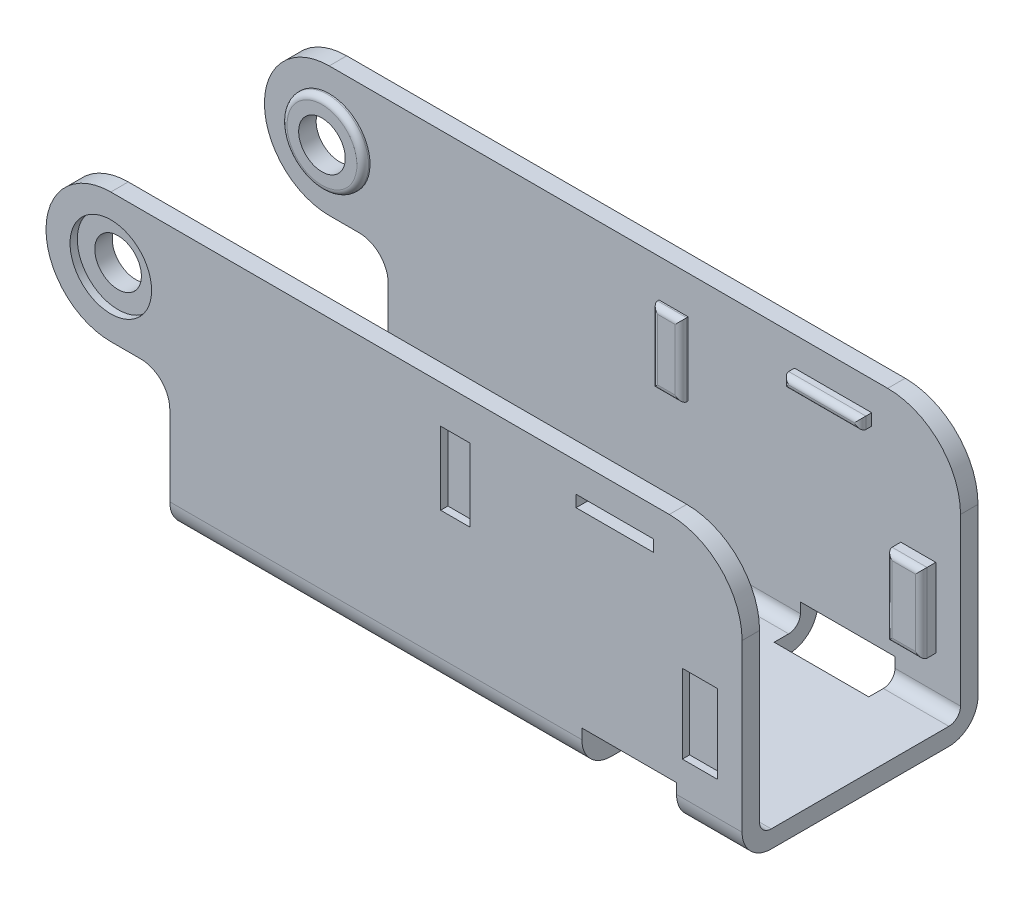
from build123d import *

# Parameters (mm, degrees)
BOSS_EXTRUDE1_DEPTH       = 10.287
SKETCH2_R                 = 3.556
CUT_EXTRUDE1_DEPTH        = 0.635
SKETCH3_W                 = 3.048
SKETCH3_H                 = 6.858
CUT_EXTRUDE2_DEPTH        = 0.635
SKETCH4_W                 = 6.731
SKETCH4_H                 = 1.016
CUT_EXTRUDE3_DEPTH        = 1.016
SKETCH5_W                 = 2.54
SKETCH5_H                 = 6.35
CUT_EXTRUDE4_DEPTH        = 0.635
FILLET1_R                 = 6.35
FILLET2_R                 = 2.54
CUT_EXTRUDE5_DEPTH        = 66.856694641
SKETCH9_W                 = 2.54
SKETCH9_H                 = 6.35
SKETCH9_R                 = 3.556
BOSS_EXTRUDE2_DEPTH       = 0.635
SKETCH10_W                = 6.731
SKETCH10_H                = 1.016
BOSS_EXTRUDE3_DEPTH       = 1.016
SKETCH12_W                = 3.048
SKETCH12_H                = 6.858
BOSS_EXTRUDE4_DEPTH       = 1.27
FILLET5_R                 = 0.508
FILLET5_OF_MIRROR4_R      = 0.508
F_1_0_16_DIAMETER_HOLE1_D = 4.064
SKETCH15_R                = 1.651
BOSS_EXTRUDE5_DEPTH       = 1.397
FILLET6_R                 = 1.397
SKETCH16_R                = 2.8575
BOSS_EXTRUDE6_DEPTH       = 3.302
SKETCH20_R                = 2.0701
CUT_EXTRUDE6_DEPTH        = 57.826504432
SKETCH21_W                = 8.255
SKETCH21_H                = 3.429
CUT_EXTRUDE7_DEPTH        = 3.81


with BuildPart() as part:
    # Sketch1 → Boss-Extrude1 (new, symmetric)
    with BuildSketch(Plane.XY):
        with BuildLine():
            Line((0, 0), (49.911, 0))
            Line((49.911, 0), (49.911, 23.368))
            Line((49.911, 23.368), (-5.1435, 23.368))
            ThreePointArc((-5.1435, 23.368), (-10.795, 17.7165), (-5.1435, 12.065))
            Line((-5.1435, 12.065), (0, 12.065))
            Line((0, 12.065), (0, 0))
        make_face()
    extrude(amount=BOSS_EXTRUDE1_DEPTH, both=True)

    # Sketch2 → Cut-Extrude1 (cut)
    with BuildSketch(Plane.XY.offset(10.287)):
        with Locations((-5.1435, 17.7165)):
            Circle(SKETCH2_R)
    cut_extrude1 = extrude(amount=-CUT_EXTRUDE1_DEPTH, mode=Mode.SUBTRACT)

    # Mirror1: Cut-Extrude1 across plane
    add(cut_extrude1.mirror(Plane.XY), mode=Mode.SUBTRACT)

    # Sketch3 → Cut-Extrude2 (cut)
    with BuildSketch(Plane.XY.offset(10.287)):
        with Locations((46.228, 8.89)):
            Rectangle(SKETCH3_W, SKETCH3_H)
    cut_extrude2 = extrude(amount=-CUT_EXTRUDE2_DEPTH, mode=Mode.SUBTRACT)

    # Sketch4 → Cut-Extrude3 (cut)
    with BuildSketch(Plane.XY.offset(10.287)):
        with Locations((38.7985, 20.32)):
            Rectangle(SKETCH4_W, SKETCH4_H)
    cut_extrude3 = extrude(amount=-CUT_EXTRUDE3_DEPTH, mode=Mode.SUBTRACT)

    # Sketch5 → Cut-Extrude4 (cut)
    with BuildSketch(Plane.XY.offset(10.287)):
        with Locations((24.892, 16.891)):
            Rectangle(SKETCH5_W, SKETCH5_H)
    cut_extrude4 = extrude(amount=-CUT_EXTRUDE4_DEPTH, mode=Mode.SUBTRACT)

    # Mirror2: Cut-Extrude2, Cut-Extrude3, Cut-Extrude4 across plane
    add(cut_extrude2.mirror(Plane.XY), mode=Mode.SUBTRACT)
    add(cut_extrude3.mirror(Plane.XY), mode=Mode.SUBTRACT)
    add(cut_extrude4.mirror(Plane.XY), mode=Mode.SUBTRACT)

    # Fillet1
    fillet1_edges = [part.edges().sort_by_distance(p)[0] for p in [
        (49.911, 23.368, 0),
    ]]
    fillet(fillet1_edges, radius=FILLET1_R)

    # Fillet2
    fillet2_edges = [part.edges().sort_by_distance(p)[0] for p in [
        (0, 12.065, 0),
        (24.9555, 0, -10.287),
        (24.9555, 0, 10.287),
    ]]
    fillet(fillet2_edges, radius=FILLET2_R)

    # Sketch8 → Cut-Extrude5 (cut, through all)
    with BuildSketch(Plane(origin=(49.911, 0, 0), x_dir=(0, 0, -1), z_dir=(1, 0, 0))):
        with BuildLine():
            Line((-8.763, 23.368), (-8.763, 2.54))
            ThreePointArc((-8.763, 2.54), (-8.46542049, 1.82157951), (-7.747, 1.524))
            Line((-7.747, 1.524), (7.747, 1.524))
            ThreePointArc((7.747, 1.524), (8.46542049, 1.82157951), (8.763, 2.54))
            Line((8.763, 2.54), (8.763, 23.368))
            Line((8.763, 23.368), (-8.763, 23.368))
        make_face()
    extrude(amount=-CUT_EXTRUDE5_DEPTH, mode=Mode.SUBTRACT)

    # Sketch9 → Boss-Extrude2 (add)
    with BuildSketch(Plane(origin=(0, 0, 8.763), x_dir=(-1, 0, 0), z_dir=(0, 0, -1))):
        with Locations((-24.892, 16.891)):
            Rectangle(SKETCH9_W, SKETCH9_H)
        with Locations(Location((5.1435, 17.7165, 0), (0, 0, 180))):
            Circle(SKETCH9_R)
    boss_extrude2 = extrude(amount=BOSS_EXTRUDE2_DEPTH)

    # Sketch10 → Boss-Extrude3 (add)
    with BuildSketch(Plane(origin=(0, 0, 8.763), x_dir=(-1, 0, 0), z_dir=(0, 0, -1))):
        with Locations((-38.7985, 20.32)):
            Rectangle(SKETCH10_W, SKETCH10_H)
    boss_extrude3 = extrude(amount=BOSS_EXTRUDE3_DEPTH)

    # Sketch12 → Boss-Extrude4 (add)
    with BuildSketch(Plane(origin=(0, 0, 8.763), x_dir=(-1, 0, 0), z_dir=(0, 0, -1))):
        with Locations((-46.228, 8.89)):
            Rectangle(SKETCH12_W, SKETCH12_H)
    boss_extrude4 = extrude(amount=BOSS_EXTRUDE4_DEPTH)

    # Fillet5
    fillet5_edges = [part.edges().sort_by_distance(p)[0] for p in [
        (26.162, 16.891, 8.128),
        (24.892, 13.716, 8.128),
        (23.622, 16.891, 8.128),
        (24.892, 20.066, 8.128),
        (-8.6995, 17.7165, 8.128),
        (38.7985, 20.828, 7.747),
        (42.164, 20.32, 7.747),
        (38.7985, 19.812, 7.747),
        (35.433, 20.32, 7.747),
        (46.228, 12.319, 7.493),
        (47.752, 8.89, 7.493),
        (46.228, 5.461, 7.493),
        (44.704, 8.89, 7.493),
    ]]
    fillet(fillet5_edges, radius=FILLET5_R - 0.0001)  # a hair under: the kernel refuses the full size

    # Mirror4: Boss-Extrude2, Boss-Extrude3, Boss-Extrude4 across plane
    add(boss_extrude2.mirror(Plane.XY))
    add(boss_extrude3.mirror(Plane.XY))
    add(boss_extrude4.mirror(Plane.XY))

    # Fillet5 of Mirror4
    fillet5_of_mirror4_edges = [part.edges().sort_by_distance(p)[0] for p in [
        (26.162, 16.891, -8.128),
        (24.892, 13.716, -8.128),
        (23.622, 16.891, -8.128),
        (24.892, 20.066, -8.128),
        (-8.6995, 17.7165, -8.128),
        (38.7985, 20.828, -7.747),
        (42.164, 20.32, -7.747),
        (38.7985, 19.812, -7.747),
        (35.433, 20.32, -7.747),
        (46.228, 12.319, -7.493),
        (47.752, 8.89, -7.493),
        (46.228, 5.461, -7.493),
        (44.704, 8.89, -7.493),
    ]]
    fillet(fillet5_of_mirror4_edges, radius=FILLET5_OF_MIRROR4_R - 0.0001)  # a hair under: the kernel refuses the full size

    # 1 (0.16) Diameter Hole1 (through all)
    with Locations(Plane.XY.offset(9.652)):
        with Locations((-5.1435, 17.7165)):
            Hole(F_1_0_16_DIAMETER_HOLE1_D / 2)

    # Sketch15 → Boss-Extrude5 (add)
    with BuildSketch(Plane.XZ):
        with Locations(Location((4.9911, 0, 0), (0, 0, 90))):
            Circle(SKETCH15_R)
        with Locations(Location((44.6786, 0, 0), (0, 0, 90))):
            Circle(SKETCH15_R)
    extrude(amount=BOSS_EXTRUDE5_DEPTH)

    # Fillet6
    fillet6_edges = [part.edges().sort_by_distance(p)[0] for p in [
        (4.9911, -1.397, -1.651),
        (44.6786, -1.397, -1.651),
    ]]
    fillet(fillet6_edges, radius=FILLET6_R - 0.0001)  # a hair under: the kernel refuses the full size

    # Sketch16 → Boss-Extrude6 (add)
    with BuildSketch(Plane.XZ.offset(-1.524)):
        with Locations(Location((13.0556, 0, 0), (0, 0, 90))):
            Circle(SKETCH16_R)
        with Locations(Location((36.6141, 0, 0), (0, 0, 90))):
            Circle(SKETCH16_R)
    extrude(amount=BOSS_EXTRUDE6_DEPTH)

    # Sketch20 → Cut-Extrude6 (cut, through all)
    with BuildSketch(Plane.XZ.offset(1.778)):
        with Locations(Location((13.0556, 0, 0), (0, 0, 270))):
            Circle(SKETCH20_R)
        with Locations(Location((36.6141, 0, 0), (0, 0, 270))):
            Circle(SKETCH20_R)
    extrude(amount=-CUT_EXTRUDE6_DEPTH, mode=Mode.SUBTRACT)

    # Sketch21 → Cut-Extrude7 (cut)
    with BuildSketch(Plane.XY.offset(10.287)):
        with Locations((40.0685, 1.7145)):
            Rectangle(SKETCH21_W, SKETCH21_H)
    cut_extrude7 = extrude(amount=-CUT_EXTRUDE7_DEPTH, mode=Mode.SUBTRACT)

    # Mirror5: Cut-Extrude7 across plane
    add(cut_extrude7.mirror(Plane.XY), mode=Mode.SUBTRACT)


solid = part.part
